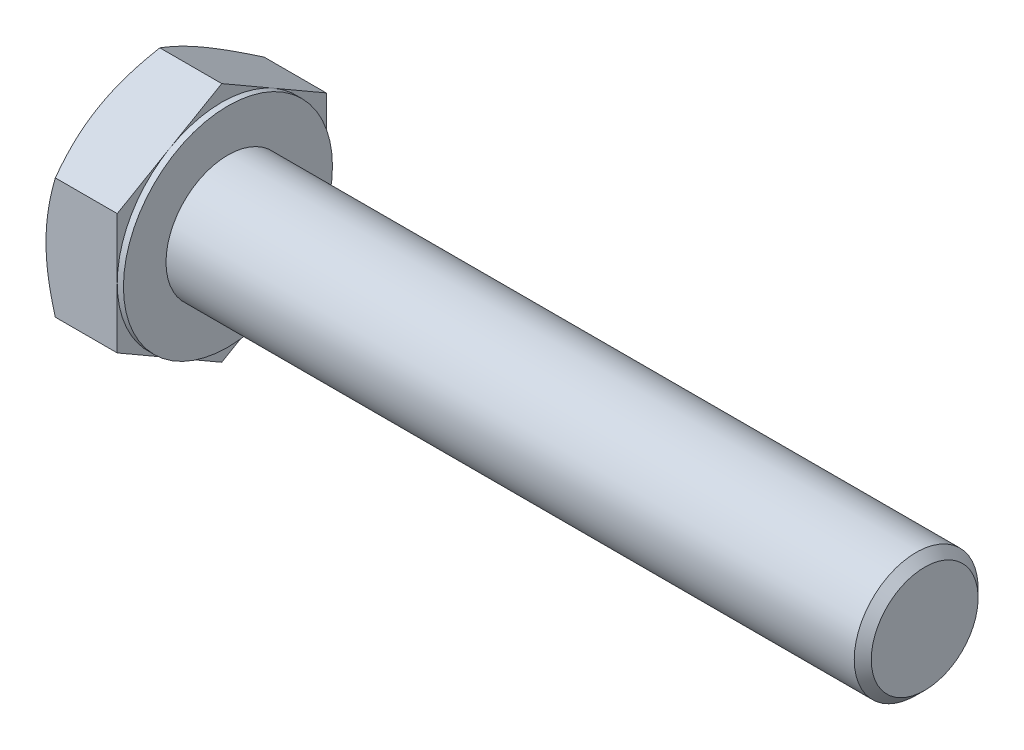
from build123d import *

# Parameters (mm, degrees)
BASEHEAD_DEPTH = 10
SKETCH4_W      = 0.8
SKETCH4_H      = 12.088457268


# Read off the part's stored shape, not the designer's step: HeadChamfer
with BuildPart() as part:
    # Sketch1 → BaseHead (new body)
    with BuildSketch(Plane(origin=(0, 0, 0), x_dir=(0, 0, -1), z_dir=(1, 0, 0))):
        Polygon((13.5, 7.794228634), (13.5, -7.794228634), (0, -15.588457268), (-13.5, -7.794228634), (-13.5, 7.794228634), (0, 15.588457268), align=None)
    extrude(amount=BASEHEAD_DEPTH)

    # HeadChamfer outline → HeadChamfer (revolve, cut)
    with BuildSketch(Plane.YX):
        Polygon((15.58845727, 1.205771367), (13.499999851, -8.6e-08), (15.58845727, -8.6e-08), align=None)
    revolve(axis=Axis((0, 0, 0), (1, 0, 0)), mode=Mode.SUBTRACT)

    # HeadChamfer 2 outline → HeadChamfer 2 (revolve)
    with BuildSketch(Plane.YX):
        Polygon((8, 10), (8, 98.8985), (6.8985, 100), (0, 100), (0, 10), align=None)
    revolve(axis=Axis((0, 0, 0), (1, 0, 0)))

    # Sketch4 → BearingFace (revolve, cut)
    with BuildSketch(Plane.XY, mode=Mode.PRIVATE) as bearingface_sk:
        with Locations((9.6, 19.544228634)):
            Rectangle(SKETCH4_W, SKETCH4_H)
    revolve(bearingface_sk.sketch.rotate(Axis((0, 0, 0), (1, 0, 0)), 90), axis=Axis((0, 0, 0), (1, 0, 0)), mode=Mode.SUBTRACT)


solid = part.part
